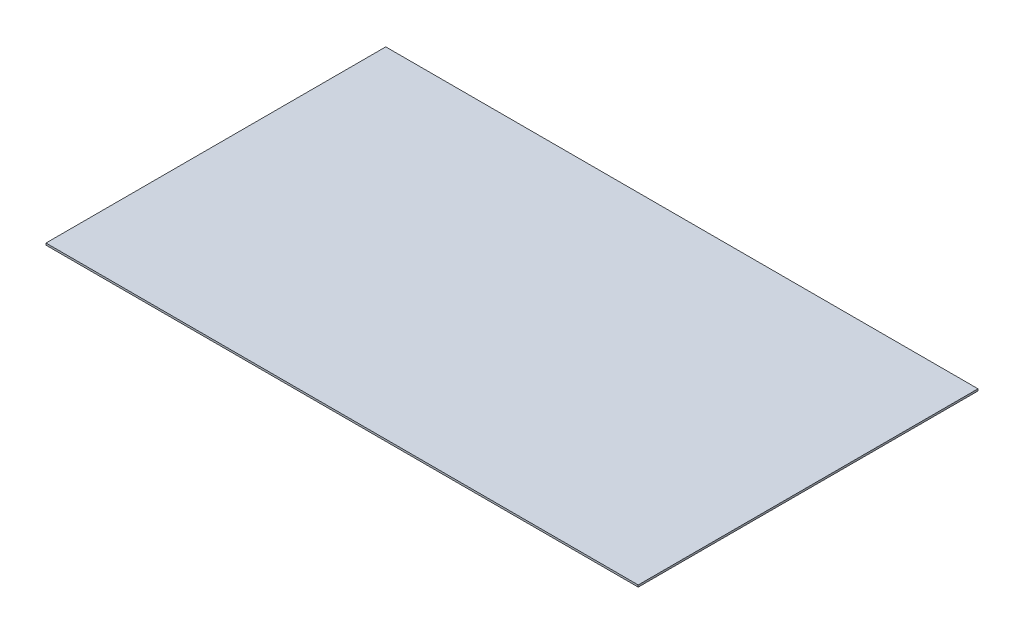
from build123d import *

# Parameters (mm, degrees)
SKETCH1_W           = 69.725
SKETCH1_H           = 40
BOSS_EXTRUDE1_DEPTH = 0.1125


with BuildPart() as part:
    # Sketch1 → Boss-Extrude1 (new, symmetric)
    with BuildSketch(Plane(origin=(0, 0, 0), x_dir=(1, 0, 0), z_dir=(0, 1, 0))):
        Rectangle(SKETCH1_W, SKETCH1_H)
    extrude(amount=BOSS_EXTRUDE1_DEPTH, both=True)


solid = part.part
